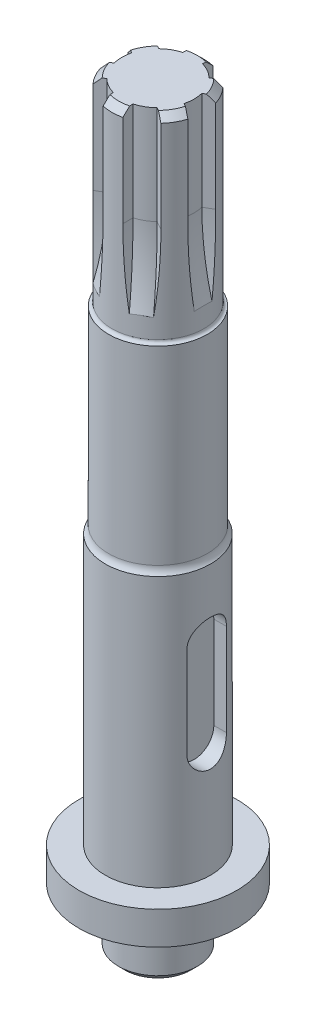
from build123d import *

# Parameters (mm, degrees)
SKETCH1_R           = 6.000000000000001
BOSS_EXTRUDE1_DEPTH = 9
SKETCH2_R           = 12
BOSS_EXTRUDE2_DEPTH = 5
SKETCH3_R           = 8
BOSS_EXTRUDE3_DEPTH = 41
SKETCH4_R           = 7.5
BOSS_EXTRUDE4_DEPTH = 30
SKETCH5_R           = 7
BOSS_EXTRUDE5_DEPTH = 30
CHAMFER1_SIZE       = 1
FILLET1_R           = 1.5
FILLET2_R           = 0.5
CUT_EXTRUDE1_DEPTH  = 2.5
CUT_EXTRUDE2_START  = -15
CUT_EXTRUDE2_DEPTH  = 15
CHAMFER2_SIZE       = 1
CHAMFER3_SIZE       = 1
CHAMFER4_SIZE       = 1
CHAMFER5_SIZE       = 1
CHAMFER6_SIZE       = 1
CHAMFER7_SIZE       = 1


# Some blends are built 0.0001 mm under size
with BuildPart() as part:
    # Sketch1 → Boss-Extrude1 (new body)
    with BuildSketch(Plane(origin=(0, 0, 0), x_dir=(1, 0, 0), z_dir=(0, 1, 0))):
        with Locations(Location((0, 0, 0), (0, 0, 270))):
            Circle(SKETCH1_R)
    extrude(amount=BOSS_EXTRUDE1_DEPTH)

    # Sketch2 → Boss-Extrude2 (add)
    with BuildSketch(Plane(origin=(0, 9, 0), x_dir=(1, 0, 0), z_dir=(0, 1, 0))):
        with Locations(Location((0, 0, 0), (0, 0, 270))):
            Circle(SKETCH2_R)
    extrude(amount=BOSS_EXTRUDE2_DEPTH)

    # Sketch3 → Boss-Extrude3 (add)
    with BuildSketch(Plane(origin=(0, 13.999999999999998, 0), x_dir=(1, 0, 0), z_dir=(0, 1, 0))):
        with Locations(Location((0, 0, 0), (0, 0, 270))):
            Circle(SKETCH3_R)
    extrude(amount=BOSS_EXTRUDE3_DEPTH)

    # Sketch4 → Boss-Extrude4 (add)
    with BuildSketch(Plane(origin=(0, 55, 0), x_dir=(1, 0, 0), z_dir=(0, 1, 0))):
        with Locations(Location((0, 0, 0), (0, 0, 270))):
            Circle(SKETCH4_R)
    extrude(amount=BOSS_EXTRUDE4_DEPTH)

    # Sketch5 → Boss-Extrude5 (add)
    with BuildSketch(Plane(origin=(0, 84.99999999999999, 0), x_dir=(1, 0, 0), z_dir=(0, 1, 0))):
        with Locations(Location((0, 0, 0), (0, 0, 270))):
            Circle(SKETCH5_R)
    extrude(amount=BOSS_EXTRUDE5_DEPTH)

    # Chamfer1
    chamfer1_edges = [part.edges().sort_by_distance(p)[0] for p in [
        (1.84e-15, 0, -6.000000000000001),
    ]]
    chamfer(chamfer1_edges, length=CHAMFER1_SIZE)

    # Fillet1
    # the kernel refuses this fillet: 1.5 mm, written as the material it adds along each edge
    with BuildSketch(Plane(origin=(0, 55, 0), x_dir=(-1.8e-16, 0, 1), z_dir=(-1, 0, -1.8e-16))) as fillet1_piece_1:
        with BuildLine():
            CenterArc((9, 1.1180339887498931), FILLET1_R, 180, 48.189685104221326)
            Line((7.5, 1.1180339887498931), (7.47, 1.1180339887498931))
            Line((7.47, 1.1180339887498931), (7.47, 0))
            Line((7.47, 0), (7.5, -0.03000000000000114))
            ThreePointArc((7.5, -0.03000000000000114), (7.75, -0.03000000000000114), (7.9799999999999995, -0.022360679774998))
            Line((7.9799999999999995, -0.022360679774998), (7.999999999999999, 0))
        make_face()
    revolve(axis=Axis((0, 55, 0), (0, 1, 0)))

    # Fillet2
    fillet2_edges = [part.edges().sort_by_distance(p)[0] for p in [
        (2.14e-15, 84.99999999999999, -7),
    ]]
    fillet(fillet2_edges, radius=FILLET2_R - 0.0001)  # a hair under: the kernel refuses the full size

    # Sketch7 → Cut-Extrude1 (cut)
    with BuildSketch(Plane(origin=(8, 0, 0), x_dir=(0, 0, -1), z_dir=(1, 0, 0))):
        with BuildLine():
            Line((3.0000000000000053, 45), (2.9999999999999982, 31))
            ThreePointArc((2.9999999999999982, 31), (2.85e-15, 28), (-2.9999999999999956, 31))
            Line((-2.9999999999999956, 31), (-2.9999999999999947, 45))
            ThreePointArc((-2.9999999999999947, 45), (1.8e-16, 48.00000000000001), (3.0000000000000053, 45))
        make_face()
    extrude(amount=-CUT_EXTRUDE1_DEPTH, mode=Mode.SUBTRACT)

    # Sketch8 → Cut-Extrude2 (cut)
    with BuildSketch(Plane(origin=(0, 114.99999999999999, 0), x_dir=(1, 0, 0), z_dir=(0, 1, 0)).offset(CUT_EXTRUDE2_START)):
        with BuildLine():
            ThreePointArc((7, 0), (6.917352003770826, 1.0724930097337437), (6.671359641163502, 2.1196604771176903))
            Line((6.671359641163496, 2.119660477117689), (5.332575694955831, 1.3467132053879431))
            ThreePointArc((5.332575694955837, 1.3467132053879445), (5.457983433570365, 0.6785402264209899), (5.5, 0))
            ThreePointArc((5.5, -1.35e-15), (5.457983433570367, -0.6785402264209729), (5.332575694955845, -1.34671320538791))
            Line((5.332575694955836, -1.346713205387908), (6.671359641163502, -2.119660477117653))
            ThreePointArc((6.671359641163512, -2.1196604771176566), (6.917352003770828, -1.0724930097337273), (7, -1.71e-15))
        make_face()
        with BuildLine():
            ThreePointArc((5.171359641163496, 4.717736688471005), (3.499999999999994, 6.062177826491074), (1.4999999999999998, 6.837397165588671))
            Line((1.5, 6.837397165588672), (1.5, 5.2915026221291805))
            ThreePointArc((1.4999999999999996, 5.291502622129181), (2.7499999999999933, 4.763139720814417), (3.832575694955829, 3.944789416741259))
            Line((3.8325756949558296, 3.9447894167412603), (5.171359641163496, 4.717736688471005))
        make_face()
        with BuildLine():
            Line((-1.5, 5.2915026221291805), (-1.5, 6.837397165588672))
            ThreePointArc((-1.5000000000000002, 6.837397165588671), (-3.4999999999999982, 6.062177826491071), (-5.171359641163502, 4.717736688470998))
            Line((-5.1713596411634954, 4.717736688470993), (-3.832575694955829, 3.944789416741248))
            ThreePointArc((-3.8325756949558354, 3.944789416741253), (-2.7499999999999964, 4.763139720814414), (-1.5000000000000002, 5.291502622129181))
        make_face()
        with BuildLine():
            Line((-5.332575694955827, 1.3467132053879316), (-6.671359641163493, 2.1196604771176752))
            ThreePointArc((-6.671359641163505, 2.1196604771176797), (-7, 3.97e-15), (-6.671359641163508, -2.119660477117672))
            Line((-6.671359641163487, -2.119660477117665), (-5.332575694955821, -1.3467132053879187))
            ThreePointArc((-5.3325756949558425, -1.3467132053879223), (-5.5, 5.56e-15), (-5.332575694955839, 1.3467132053879354))
        make_face()
        with BuildLine():
            Line((-3.8325756949558207, -3.944789416741234), (-5.171359641163486, -4.71773668847098))
            ThreePointArc((-5.171359641163504, -4.717736688470995), (-3.4999999999999973, -6.062177826491071), (-1.499999999999996, -6.837397165588672))
            Line((-1.4999999999999905, -6.837397165588645), (-1.4999999999999907, -5.291502622129154))
            ThreePointArc((-1.499999999999998, -5.291502622129181), (-2.749999999999998, -4.763139720814413), (-3.832575694955838, -3.9447894167412505))
        make_face()
        with BuildLine():
            ThreePointArc((1.5000000000000118, -6.837397165588669), (3.5000000000000115, -6.062177826491064), (5.171359641163515, -4.717736688470984))
            Line((5.171359641163502, -4.717736688470969), (3.832575694955836, -3.9447894167412247))
            ThreePointArc((3.8325756949558474, -3.944789416741241), (2.7500000000000133, -4.763139720814405), (1.5000000000000149, -5.291502622129177))
            Line((1.5000000000000093, -5.291502622129155), (1.5000000000000095, -6.837397165588644))
        make_face()
    extrude(amount=CUT_EXTRUDE2_DEPTH, mode=Mode.SUBTRACT)

    # Sketch9 → Cut-Revolve3 (revolve, cut)
    with BuildSketch(Plane(origin=(0, 99.99999999999999, 0), x_dir=(1, 0, 0), z_dir=(0, 1, 0))):
        with BuildLine():
            Line((6.671359641163502, 2.1196604771176926), (5.332575694955831, 1.3467132053879434))
            ThreePointArc((5.332575694955831, 1.3467132053879434), (5.4999999999999885, 1.827e-14), (5.332575694955836, -1.3467132053879076))
            Line((5.332575694955836, -1.3467132053879076), (6.671359641163512, -2.1196604771176584))
            ThreePointArc((6.671359641163512, -2.1196604771176584), (7.000000000000002, 1.802e-14), (6.671359641163502, 2.1196604771176926))
        make_face()
    revolve(axis=Axis((50.00000000000003, 99.99999999999999, -2.1196604771176926), (0, 0, 1)), mode=Mode.SUBTRACT)

    # Sketch9<13> → Cut-Revolve5 (revolve, cut)
    with BuildSketch(Plane(origin=(0, 99.99999999999999, 0), x_dir=(1, 0, 0), z_dir=(0, 1, 0))):
        with BuildLine():
            Line((1.500000000000007, -5.291502622129168), (1.500000000000004, -6.837397165588671))
            ThreePointArc((1.5000000000000042, -6.837397165588671), (3.5000000000000058, -6.062177826491078), (5.171359641163506, -4.717736688470996))
            Line((5.171359641163505, -4.717736688470995), (3.8325756949558354, -3.944789416741244))
            ThreePointArc((3.8325756949558363, -3.944789416741244), (2.7499999999999805, -4.763139720814369), (1.5000000000000075, -5.291502622129169))
        make_face()
    revolve(axis=Axis((23.833712152559464, 99.99999999999999, 43.97462679189435), (0.8660254037844373, 0, -0.5000000000000026)), mode=Mode.SUBTRACT)

    # Sketch9<14> → Cut-Revolve6 (revolve, cut)
    with BuildSketch(Plane(origin=(0, 99.99999999999999, 0), x_dir=(1, 0, 0), z_dir=(0, 1, 0))):
        with BuildLine():
            Line((-3.832575694955836, -3.944789416741241), (-5.171359641163515, -4.717736688470986))
            ThreePointArc((-5.171359641163515, -4.7177366884709855), (-3.500000000000017, -6.062177826491071), (-1.5000000000000175, -6.837397165588671))
            Line((-1.5000000000000178, -6.83739716558867), (-1.5000000000000115, -5.2915026221291726))
            ThreePointArc((-1.5000000000000127, -5.2915026221291726), (-2.7499999999999787, -4.76313972081436), (-3.832575694955836, -3.944789416741241))
        make_face()
    revolve(axis=Axis((-26.16628784736556, 99.99999999999999, 42.62791358659284), (0.8660254037844393, 0, 0.4999999999999991)), mode=Mode.SUBTRACT)

    # Sketch9<15> → Cut-Revolve7 (revolve, cut)
    with BuildSketch(Plane(origin=(0, 99.99999999999999, 0), x_dir=(1, 0, 0), z_dir=(0, 1, 0))):
        with BuildLine():
            ThreePointArc((-5.332575694955828, 1.346713205387945), (-5.499999999999924, 2.191e-14), (-5.332575694955842, -1.346713205387906))
            Line((-5.332575694955842, -1.346713205387906), (-6.671359641163518, -2.119660477117646))
            ThreePointArc((-6.671359641163518, -2.119660477117646), (-7, 2.937e-14), (-6.671359641163499, 2.119660477117705))
            Line((-6.671359641163499, 2.119660477117705), (-5.332575694955828, 1.346713205387945))
        make_face()
    revolve(axis=Axis((-50.014845781031845, 99.99999999999999, -0.5734439438200718), (0.015462165332976084, 0, 0.9998804535759341)), mode=Mode.SUBTRACT)

    # Sketch9<16> → Cut-Revolve8 (revolve, cut)
    with BuildSketch(Plane(origin=(0, 99.99999999999999, 0), x_dir=(1, 0, 0), z_dir=(0, 1, 0))):
        with BuildLine():
            Line((-1.4999999999999702, 5.291502622129179), (-1.4999999999999565, 6.837397165588681))
            ThreePointArc((-1.499999999999957, 6.837397165588682), (-3.4999999999999547, 6.0621778264910855), (-5.171359641163473, 4.717736688471032))
            Line((-5.171359641163472, 4.71773668847103), (-3.832575694955808, 3.9447894167412705))
            ThreePointArc((-3.8325756949558087, 3.9447894167412714), (-2.7499999999999707, 4.7631397208144275), (-1.4999999999999705, 5.29150262212918))
        make_face()
    revolve(axis=Axis((-26.166287847365357, 99.99999999999999, -42.627913586592946), (0.8660254037844384, 0, -0.5000000000000007)), mode=Mode.SUBTRACT)

    # Sketch9<17> → Cut-Revolve9 (revolve, cut)
    with BuildSketch(Plane(origin=(0, 99.99999999999999, 0), x_dir=(1, 0, 0), z_dir=(0, 1, 0))):
        with BuildLine():
            Line((1.500000000000064, 6.837397165588657), (1.5000000000000466, 5.29150262212916))
            ThreePointArc((1.5000000000000466, 5.29150262212916), (2.750000000000031, 4.763139720814375), (3.8325756949558616, 3.9447894167412114))
            Line((3.8325756949558616, 3.9447894167412114), (5.171359641163546, 4.717736688470948))
            Line((5.171359641163546, 4.717736688470948), (1.500000000000064, 6.837397165588657))
        make_face()
        with BuildLine():
            Line((1.500000000000064, 6.837397165588657), (5.171359641163546, 4.717736688470948))
            ThreePointArc((5.171359641163546, 4.717736688470948), (3.5000000000000506, 6.062177826491031), (1.500000000000064, 6.837397165588657))
        make_face()
    revolve(axis=Axis((23.83371215255921, 99.99999999999999, -43.974626791894465), (0.86602540378444, 0, 0.4999999999999975)), mode=Mode.SUBTRACT)

    # Chamfer2
    chamfer2_edges = [part.edges().sort_by_distance(p)[0] for p in [
        (0.75439374363767, 114.99999999999999, 6.959230566633091),
    ]]
    chamfer(chamfer2_edges, length=CHAMFER2_SIZE)

    # Chamfer3
    chamfer3_edges = [part.edges().sort_by_distance(p)[0] for p in [
        (6.062177826491079, 114.99999999999999, 3.4999999999999845),
    ]]
    chamfer(chamfer3_edges, length=CHAMFER3_SIZE)

    # Chamfer4
    chamfer4_edges = [part.edges().sort_by_distance(p)[0] for p in [
        (6.062177826491064, 114.99999999999999, -3.500000000000011),
    ]]
    chamfer(chamfer4_edges, length=CHAMFER4_SIZE)

    # Chamfer5
    chamfer5_edges = [part.edges().sort_by_distance(p)[0] for p in [
        (2.14e-15, 114.99999999999999, -7),
    ]]
    chamfer(chamfer5_edges, length=CHAMFER5_SIZE)

    # Chamfer6
    chamfer6_edges = [part.edges().sort_by_distance(p)[0] for p in [
        (-6.062177826491068, 114.99999999999999, -3.5000000000000044),
    ]]
    chamfer(chamfer6_edges, length=CHAMFER6_SIZE)

    # Chamfer7
    chamfer7_edges = [part.edges().sort_by_distance(p)[0] for p in [
        (-6.062177826491074, 114.99999999999999, 3.4999999999999942),
    ]]
    chamfer(chamfer7_edges, length=CHAMFER7_SIZE)


solid = part.part
